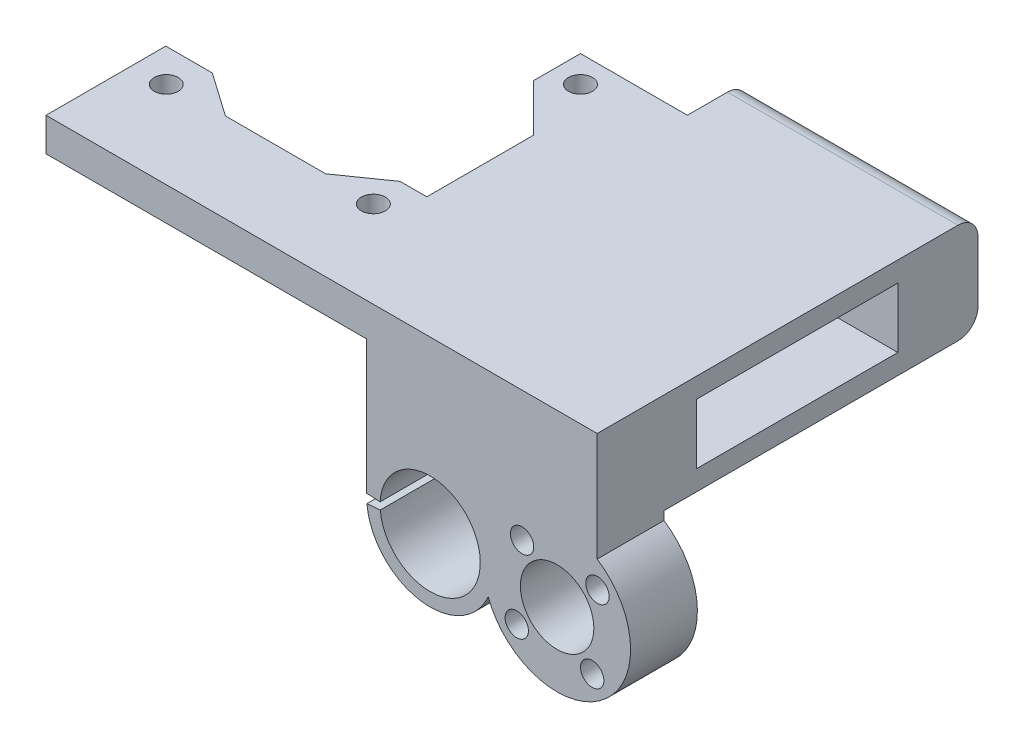
from build123d import *

# Parameters (mm, degrees)
SKETCH1_R               = 1.8
BOSS_EXTRUDE1_DEPTH     = 35
CUT_EXTRUDE1_DEPTH      = 20
FILLET1_R               = 3
CUT_EXTRUDE2_DEPTH      = 102.662431606
CUT_EXTRUDE2_DEPTH_BACK = 102.662431606
SKETCH5_W               = 48
SKETCH5_H               = 48
CUT_EXTRUDE3_DEPTH      = 30
SKETCH6_W               = 30.142
SKETCH6_H               = 9
CUT_EXTRUDE4_DEPTH      = 31.4
SKETCH7_W               = 21
SKETCH7_H               = 9
CUT_EXTRUDE5_DEPTH      = 85.173689476
SKETCH8_R               = 3.5
CUT_EXTRUDE6_DEPTH      = 1.5
SKETCH11_R              = 1.75
SKETCH11_R_2            = 5.5
BOSS_EXTRUDE3_DEPTH     = 10


with BuildPart() as part:
    # Sketch1 → Boss-Extrude1 (new body)
    with BuildSketch(Plane(origin=(0, 0, 0), x_dir=(1, 0, 0), z_dir=(0, 1, 0))):
        Polygon((0, 17.928932188), (0, 0), (82.5, 0), (82.5, 57), (48, 57), (48, 48), (32, 48), (32, 41), (39.071067812, 33.928932188), (39.071067812, 17.928932188), (35.071067812, 17.928932188), (28.517851458, 13.340320697), (13.517851458, 13.340320697), (6.964635103, 17.928932188), align=None)
        with Locations((5, 13)):
            Circle(SKETCH1_R, mode=Mode.SUBTRACT)
        with Locations((36, 13)):
            Circle(SKETCH1_R, mode=Mode.SUBTRACT)
        with Locations((36, 44)):
            Circle(SKETCH1_R, mode=Mode.SUBTRACT)
    extrude(amount=BOSS_EXTRUDE1_DEPTH)

    # Sketch2 → Cut-Extrude1 (cut)
    with BuildSketch(Plane.XZ):
        Polygon((82.5, -57), (82.5, 0), (67, 0), (67, -48), (48, -48), (48, -57), align=None)
    extrude(amount=-CUT_EXTRUDE1_DEPTH, mode=Mode.SUBTRACT)

    # Fillet1
    fillet1_edges = [part.edges().sort_by_distance(p)[0] for p in [
        (65.25, 35, -57),
        (65.25, 20, -57),
    ]]
    fillet(fillet1_edges, radius=FILLET1_R)

    # Sketch3 → Cut-Extrude2 (cut, two sides: drawn at the far end of the back side and taken through both)
    with BuildSketch(Plane(origin=(0, 0, -48), x_dir=(-1, 0, 0), z_dir=(0, 0, -1)).offset(-CUT_EXTRUDE2_DEPTH_BACK)):
        with BuildLine():
            ThreePointArc((-50.010278489, 9.892519672), (-64.998857714, 9.630893048), (-50.028539764, 8.846331929))
            Line((-50.028539764, 8.846331929), (-48.036150368, 8.672020444))
            ThreePointArc((-48.036150368, 8.672020444), (-51.081893028, 2.4958653), (-57.5, 0))
            Line((-57.5, 0), (-48, 0))
            Line((-48, 0), (-48, 9.997873903))
            Line((-48, 9.997873903), (-50.010278489, 9.892519672))
        make_face()
        with BuildLine():
            Line((-67, 0), (-57.5, 0))
            ThreePointArc((-57.5, 0), (-64.217514421, 2.782485579), (-67, 9.5))
            Line((-67, 9.5), (-67, 0))
        make_face()
    extrude(amount=CUT_EXTRUDE2_DEPTH + CUT_EXTRUDE2_DEPTH_BACK, mode=Mode.SUBTRACT)

    # Sketch5 → Cut-Extrude3 (cut)
    with BuildSketch(Plane.XZ):
        with Locations((24, -24)):
            Rectangle(SKETCH5_W, SKETCH5_H)
    extrude(amount=-CUT_EXTRUDE3_DEPTH, mode=Mode.SUBTRACT)

    # Sketch6 → Cut-Extrude4 (cut)
    with BuildSketch(Plane(origin=(82.5, 0, 0), x_dir=(0, 0, -1), z_dir=(1, 0, 0))):
        with Locations((29.929, 27.5)):
            Rectangle(SKETCH6_W, SKETCH6_H)
    extrude(amount=-CUT_EXTRUDE4_DEPTH, mode=Mode.SUBTRACT)

    # Sketch7 → Cut-Extrude5 (cut, through all)
    with BuildSketch(Plane(origin=(51.1, 0, 0), x_dir=(0, 0, -1), z_dir=(1, 0, 0))):
        with Locations((28.428932188, 27.5)):
            Rectangle(SKETCH7_W, SKETCH7_H)
    extrude(amount=-CUT_EXTRUDE5_DEPTH, mode=Mode.SUBTRACT)

    # Sketch8 → Cut-Extrude6 (cut)
    with BuildSketch(Plane.XZ.offset(-30)):
        with Locations((5, -13)):
            Circle(SKETCH8_R)
        with Locations((36, -13)):
            Circle(SKETCH8_R)
        with Locations((36, -44)):
            Circle(SKETCH8_R)
    extrude(amount=-CUT_EXTRUDE6_DEPTH, mode=Mode.SUBTRACT)

    # Sketch11 → Boss-Extrude3 (add)
    with BuildSketch(Plane.XY):
        with BuildLine():
            Line((67, 20), (67, 9.5))
            ThreePointArc((67, 9.5), (66.795496221, 7.539451607), (66.190789474, 5.663311542))
            ThreePointArc((66.190789474, 5.663311542), (83.374491132, 0.912720357), (82.5, 18.719544457))
            Line((82.5, 18.719544457), (82.5, 20))
            Line((82.5, 20), (67, 20))
        make_face()
        with Locations((82.537676642, 14.748472232)):
            Circle(SKETCH11_R, mode=Mode.SUBTRACT)
        with Locations((70.462323358, 4.251527768)):
            Circle(SKETCH11_R, mode=Mode.SUBTRACT)
        with Locations((81.748472232, 3.462323358)):
            Circle(SKETCH11_R, mode=Mode.SUBTRACT)
        with Locations((76.5, 9.5)):
            Circle(SKETCH11_R_2, mode=Mode.SUBTRACT)
        with Locations((71.251527768, 15.537676642)):
            Circle(SKETCH11_R, mode=Mode.SUBTRACT)
    extrude(amount=-BOSS_EXTRUDE3_DEPTH)


solid = part.part
